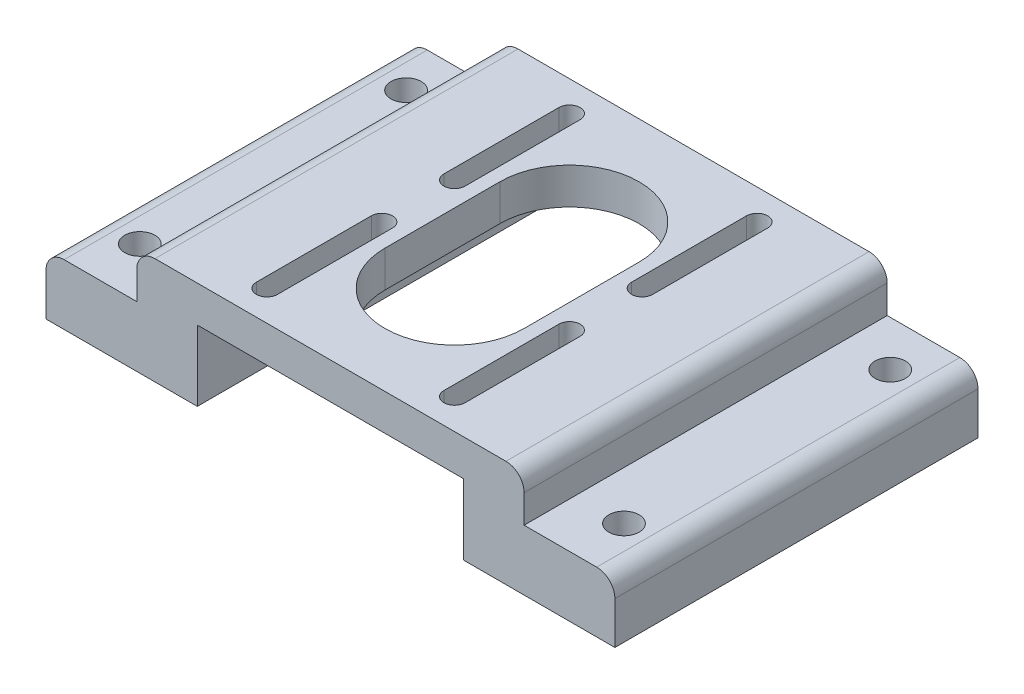
from build123d import *

# Parameters (mm, degrees)
BOSS_EXTRUDE1_DEPTH = 60
SKETCH2_R           = 2.5
CUT_EXTRUDE1_DEPTH  = 113.904926819
FILLET1_R           = 3


with BuildPart() as part:
    # Sketch1 → Boss-Extrude1 (new body)
    with BuildSketch(Plane.XY):
        Polygon((0, 0), (25, 0), (25, 11.65), (69, 11.65), (69, 0), (94, 0), (94, 10), (79, 10), (79, 17.65), (15, 17.65), (15, 10), (0, 10), align=None)
    extrude(amount=BOSS_EXTRUDE1_DEPTH)

    # Sketch2 → Cut-Extrude1 (cut, through all)
    with BuildSketch(Plane(origin=(0, 17.65, 0), x_dir=(1, 0, 0), z_dir=(0, 1, 0))):
        with Locations((7, -7.5)):
            Circle(SKETCH2_R)
        with Locations((7, -51.5)):
            Circle(SKETCH2_R)
        with Locations((87, -7.5)):
            Circle(SKETCH2_R)
        with Locations((87, -51.5)):
            Circle(SKETCH2_R)
        with BuildLine():
            Line((29.75, -36), (29.75, -55))
            ThreePointArc((29.75, -55), (31.5, -56.75), (33.25, -55))
            Line((33.25, -55), (33.25, -36))
            ThreePointArc((33.25, -36), (31.5, -34.25), (29.75, -36))
        make_face()
        with BuildLine():
            Line((29.75, -24), (29.75, -5))
            ThreePointArc((29.75, -5), (31.5, -3.25), (33.25, -5))
            Line((33.25, -5), (33.25, -24))
            ThreePointArc((33.25, -24), (31.5, -25.75), (29.75, -24))
        make_face()
        with BuildLine():
            Line((60.75, -5), (60.75, -24))
            ThreePointArc((60.75, -24), (62.5, -25.75), (64.25, -24))
            Line((64.25, -24), (64.25, -5))
            ThreePointArc((64.25, -5), (62.5, -3.25), (60.75, -5))
        make_face()
        with BuildLine():
            Line((60.75, -36), (60.75, -55))
            ThreePointArc((60.75, -55), (62.5, -56.75), (64.25, -55))
            Line((64.25, -55), (64.25, -36))
            ThreePointArc((64.25, -36), (62.5, -34.25), (60.75, -36))
        make_face()
        with BuildLine():
            Line((35.5, -20.5), (35.5, -39.5))
            ThreePointArc((35.5, -39.5), (47, -51), (58.5, -39.5))
            Line((58.5, -39.5), (58.5, -20.5))
            ThreePointArc((58.5, -20.5), (47, -9), (35.5, -20.5))
        make_face()
    extrude(amount=-CUT_EXTRUDE1_DEPTH, mode=Mode.SUBTRACT)

    # Fillet1
    fillet1_edges = [part.edges().sort_by_distance(p)[0] for p in [
        (0, 10, 30),
        (94, 10, 30),
        (79, 17.65, 30),
        (15, 17.65, 30),
    ]]
    fillet(fillet1_edges, radius=FILLET1_R)


solid = part.part
